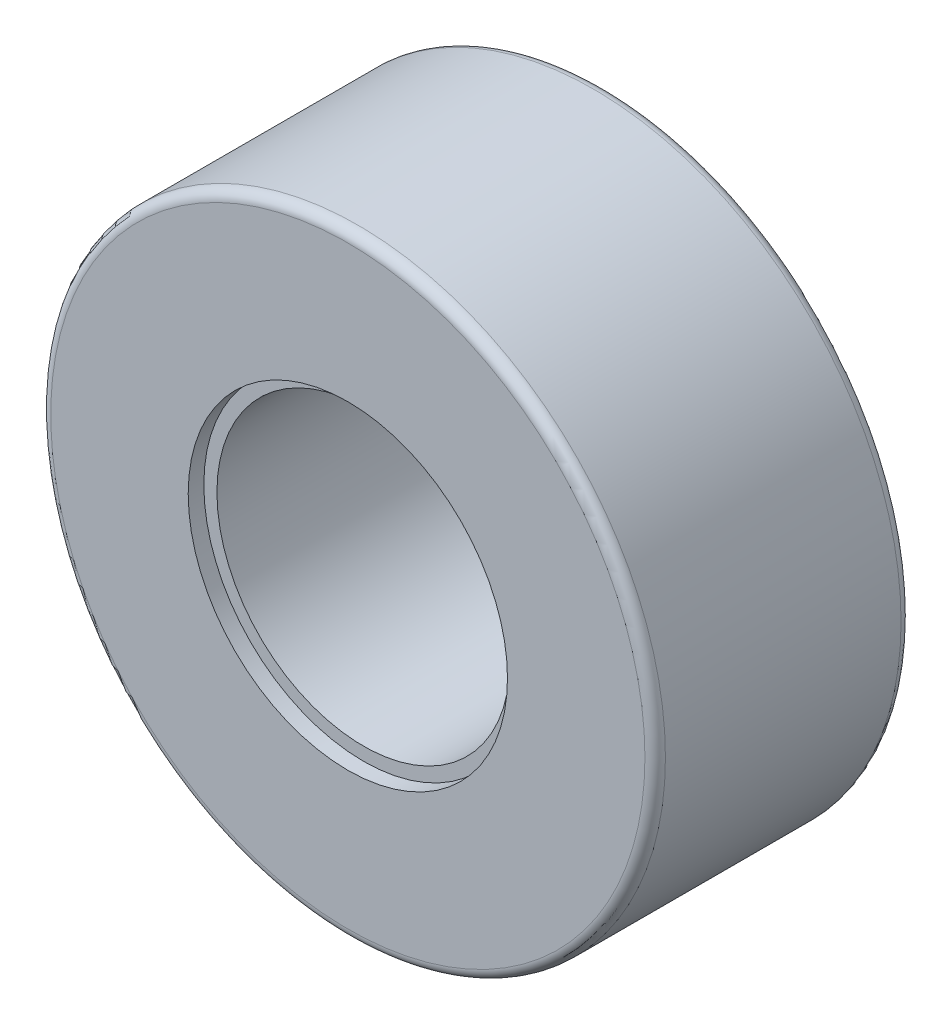
from build123d import *

# Parameters (mm, degrees)
SKETCH1_R           = 30
SKETCH1_R_2         = 14.3025
BOSS_EXTRUDE1_DEPTH = 12.5
SKETCH3_R           = 15.5825
CUT_EXTRUDE1_DEPTH  = 1.524
FILLET1_R           = 1


with BuildPart() as part:
    # Sketch1 → Boss-Extrude1 (new, symmetric)
    with BuildSketch(Plane.XY):
        Circle(SKETCH1_R)
        Circle(SKETCH1_R_2, mode=Mode.SUBTRACT)
    extrude(amount=BOSS_EXTRUDE1_DEPTH, both=True)

    # Sketch3 → Cut-Extrude1 (cut)
    with BuildSketch(Plane.XY.offset(12.5)):
        Circle(SKETCH3_R)
    cut_extrude1 = extrude(amount=-CUT_EXTRUDE1_DEPTH, mode=Mode.SUBTRACT)

    # Mirror1: Cut-Extrude1 across plane
    add(cut_extrude1.mirror(Plane.XY), mode=Mode.SUBTRACT)

    # Fillet1
    fillet1_edges = [part.edges().sort_by_distance(p)[0] for p in [
        (-30, 0, -12.5),
        (-30, 0, 12.5),
    ]]
    fillet(fillet1_edges, radius=FILLET1_R)


solid = part.part
